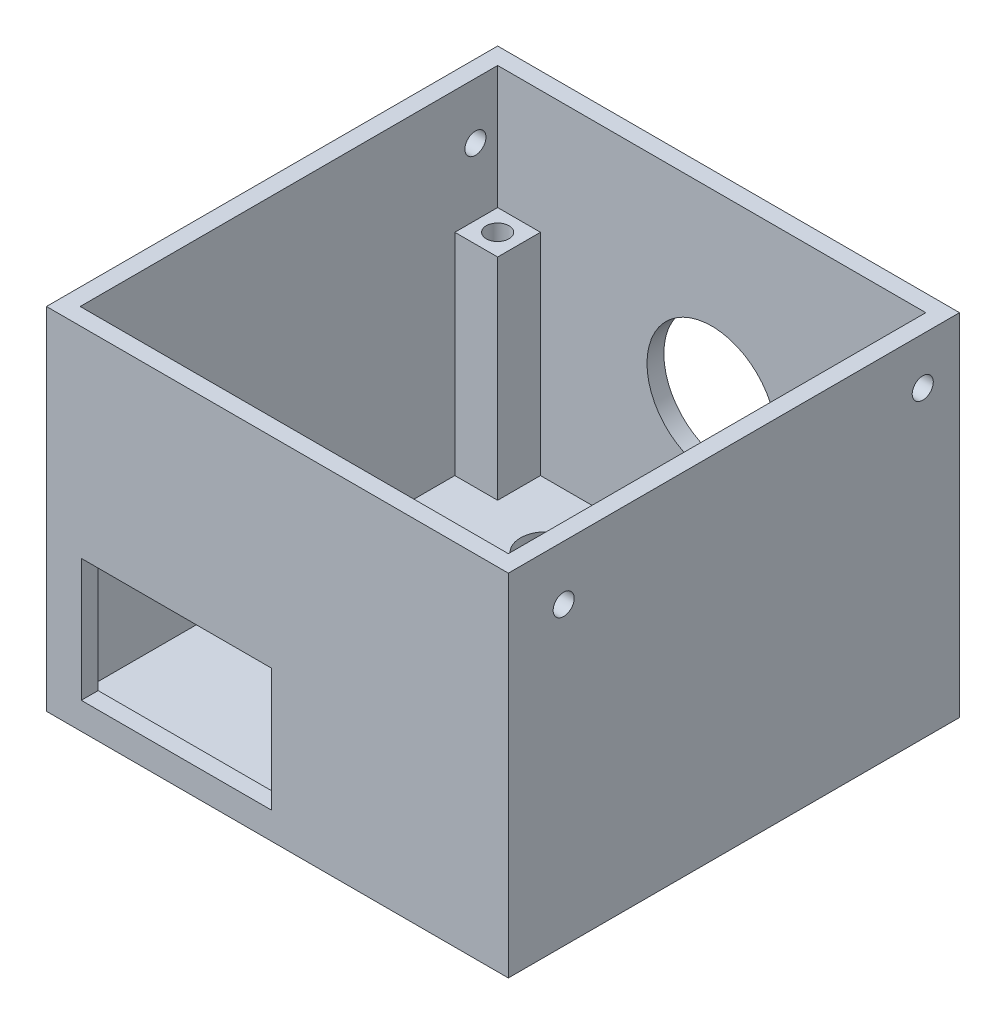
from build123d import *

# Parameters (mm, degrees)
SKETCH1_W           = 54.8
SKETCH1_H           = 53.53
BOSS_EXTRUDE1_DEPTH = 41.6
SKETCH2_W           = 50.8
SKETCH2_H           = 49.53
CUT_EXTRUDE1_DEPTH  = 39.6
SKETCH3_W           = 5.08
SKETCH3_H           = 5.08
BOSS_EXTRUDE2_DEPTH = 25
SKETCH4_R           = 1.35
CUT_EXTRUDE2_DEPTH  = 10
CUT_EXTRUDE3_REACH  = 58.548
SKETCH5_R           = 3
CUT_EXTRUDE4_REACH  = 58.548
SKETCH6_R           = 2
CUT_EXTRUDE5_REACH  = 58.548
SKETCH7_R           = 3.6
CUT_EXTRUDE6_REACH  = 75.824
SKETCH8_R           = 1.25
CUT_EXTRUDE7_REACH  = 75.824
SKETCH10_R          = 1.25
CUT_EXTRUDE8_REACH  = 75.122
SKETCH12_R          = 7.680495542
CUT_EXTRUDE9_REACH  = 75.122
SKETCH13_W          = 22.581735489
SKETCH13_H          = 14.589690318
CUT_EXTRUDE10_REACH = 75.824
SKETCH14_R          = 1.25


with BuildPart() as part:
    # Sketch1 → Boss-Extrude1 (new body)
    with BuildSketch(Plane(origin=(0, 0, 0), x_dir=(1, 0, 0), z_dir=(0, 1, 0))):
        Rectangle(SKETCH1_W, SKETCH1_H)
    extrude(amount=BOSS_EXTRUDE1_DEPTH)

    # Sketch2 → Cut-Extrude1 (cut)
    with BuildSketch(Plane(origin=(0, 41.6, 0), x_dir=(1, 0, 0), z_dir=(0, 1, 0))):
        Rectangle(SKETCH2_W, SKETCH2_H)
    extrude(amount=-CUT_EXTRUDE1_DEPTH, mode=Mode.SUBTRACT)

    # Sketch3 → Boss-Extrude2 (add)
    with BuildSketch(Plane(origin=(0, 2, 0), x_dir=(1, 0, 0), z_dir=(0, 1, 0))):
        with Locations((-22.86, 22.225)):
            Rectangle(SKETCH3_W, SKETCH3_H)
        with Locations((22.86, 22.225)):
            Rectangle(SKETCH3_W, SKETCH3_H)
        with Locations((22.86, -22.225)):
            Rectangle(SKETCH3_W, SKETCH3_H)
    extrude(amount=BOSS_EXTRUDE2_DEPTH)

    # Sketch4 → Cut-Extrude2 (cut)
    with BuildSketch(Plane(origin=(0, 27, 0), x_dir=(1, 0, 0), z_dir=(0, 1, 0))):
        with Locations((-22.86, 22.225)):
            Circle(SKETCH4_R)
        with Locations((22.86, 22.225)):
            Circle(SKETCH4_R)
        with Locations((22.86, -22.225)):
            Circle(SKETCH4_R)
    extrude(amount=-CUT_EXTRUDE2_DEPTH, mode=Mode.SUBTRACT)

    # Sketch5 → Cut-Extrude3 (cut, up to next)
    with BuildSketch(Plane(origin=(0, 0, 0), x_dir=(-1, 0, 0), z_dir=(0, -1, 0)), mode=Mode.PRIVATE) as cut_extrude3_sk1:
        with Locations((-12.762863618, 17.186859774)):
            Circle(SKETCH5_R)
    cut_extrude3_tool1 = extrude(cut_extrude3_sk1.sketch, amount=-CUT_EXTRUDE3_REACH, mode=Mode.PRIVATE) & part.part
    # Sketch5 → Cut-Extrude3 (cut, up to next)
    with BuildSketch(Plane(origin=(0, 0, 0), x_dir=(-1, 0, 0), z_dir=(0, -1, 0)), mode=Mode.PRIVATE) as cut_extrude3_sk2:
        with Locations((12.108357792, 17.186859774)):
            Circle(SKETCH5_R)
    cut_extrude3_tool2 = extrude(cut_extrude3_sk2.sketch, amount=-CUT_EXTRUDE3_REACH, mode=Mode.PRIVATE) & part.part
    add(cut_extrude3_tool1.solids().sort_by_distance((12.762864, 0, -17.18686))[0], mode=Mode.SUBTRACT)
    add(cut_extrude3_tool2.solids().sort_by_distance((-12.108358, 0, -17.18686))[0], mode=Mode.SUBTRACT)

    # Sketch6 → Cut-Extrude4 (cut, up to next)
    with BuildSketch(Plane(origin=(0, 0, 0), x_dir=(-1, 0, 0), z_dir=(0, -1, 0)), mode=Mode.PRIVATE) as cut_extrude4_sk1:
        with Locations((-16.764285658, 3.623143307)):
            Circle(SKETCH6_R)
    cut_extrude4_tool1 = extrude(cut_extrude4_sk1.sketch, amount=-CUT_EXTRUDE4_REACH, mode=Mode.PRIVATE) & part.part
    # Sketch6 → Cut-Extrude4 (cut, up to next)
    with BuildSketch(Plane(origin=(0, 0, 0), x_dir=(-1, 0, 0), z_dir=(0, -1, 0)), mode=Mode.PRIVATE) as cut_extrude4_sk2:
        with Locations((-16.764285658, -2.073626677)):
            Circle(SKETCH6_R)
    cut_extrude4_tool2 = extrude(cut_extrude4_sk2.sketch, amount=-CUT_EXTRUDE4_REACH, mode=Mode.PRIVATE) & part.part
    add(cut_extrude4_tool1.solids().sort_by_distance((16.764286, 0, -3.623143))[0], mode=Mode.SUBTRACT)
    add(cut_extrude4_tool2.solids().sort_by_distance((16.764286, 0, 2.073627))[0], mode=Mode.SUBTRACT)

    # Sketch7 → Cut-Extrude5 (cut, up to next)
    with BuildSketch(Plane(origin=(0, 0, 0), x_dir=(-1, 0, 0), z_dir=(0, -1, 0)), mode=Mode.PRIVATE) as cut_extrude5_sk1:
        with Locations((-16.67782341, -12.007632718)):
            Circle(SKETCH7_R)
    cut_extrude5_tool1 = extrude(cut_extrude5_sk1.sketch, amount=-CUT_EXTRUDE5_REACH, mode=Mode.PRIVATE) & part.part
    add(cut_extrude5_tool1.solids().sort_by_distance((16.677823, 0, 12.007633))[0], mode=Mode.SUBTRACT)

    # Sketch8 → Cut-Extrude6 (cut, up to next)
    with BuildSketch(Plane(origin=(27.4, 0, 0), x_dir=(0, 0, -1), z_dir=(1, 0, 0)), mode=Mode.PRIVATE) as cut_extrude6_sk1:
        with Locations((-20.200858991, 35.113292919)):
            Circle(SKETCH8_R)
    cut_extrude6_tool1 = extrude(cut_extrude6_sk1.sketch, amount=-CUT_EXTRUDE6_REACH, mode=Mode.PRIVATE) & part.part
    add(cut_extrude6_tool1.solids().sort_by_distance((27.4, 35.113293, 20.200859))[0], mode=Mode.SUBTRACT)

    # Sketch10 → Cut-Extrude7 (cut, up to next)
    with BuildSketch(Plane.ZY.offset(27.4), mode=Mode.PRIVATE) as cut_extrude7_sk1:
        with Locations((-22.126795963, 34.935427745)):
            Circle(SKETCH10_R)
    cut_extrude7_tool1 = extrude(cut_extrude7_sk1.sketch, amount=-CUT_EXTRUDE7_REACH, mode=Mode.PRIVATE) & part.part
    add(cut_extrude7_tool1.solids().sort_by_distance((-27.4, 34.935428, -22.126796))[0], mode=Mode.SUBTRACT)

    # Sketch12 → Cut-Extrude8 (cut, up to next)
    with BuildSketch(Plane(origin=(0, 0, -26.765), x_dir=(-1, 0, 0), z_dir=(0, 0, -1)), mode=Mode.PRIVATE) as cut_extrude8_sk1:
        with Locations((0, 19.850785186)):
            Circle(SKETCH12_R)
    cut_extrude8_tool1 = extrude(cut_extrude8_sk1.sketch, amount=-CUT_EXTRUDE8_REACH, mode=Mode.PRIVATE) & part.part
    add(cut_extrude8_tool1.solids().sort_by_distance((0, 19.850785, -26.765))[0], mode=Mode.SUBTRACT)

    # Sketch13 → Cut-Extrude9 (cut, up to next)
    with BuildSketch(Plane.XY.offset(26.765), mode=Mode.PRIVATE) as cut_extrude9_sk1:
        with Locations((-11.980612505, 10.491224969)):
            Rectangle(SKETCH13_W, SKETCH13_H)
    cut_extrude9_tool1 = extrude(cut_extrude9_sk1.sketch, amount=-CUT_EXTRUDE9_REACH, mode=Mode.PRIVATE) & part.part
    add(cut_extrude9_tool1.solids().sort_by_distance((-11.980613, 10.491225, 26.765))[0], mode=Mode.SUBTRACT)

    # Sketch14 → Cut-Extrude10 (cut, up to next)
    with BuildSketch(Plane(origin=(27.4, 0, 0), x_dir=(0, 0, -1), z_dir=(1, 0, 0)), mode=Mode.PRIVATE) as cut_extrude10_sk1:
        with Locations((22.403153775, 36.040667921)):
            Circle(SKETCH14_R)
    cut_extrude10_tool1 = extrude(cut_extrude10_sk1.sketch, amount=-CUT_EXTRUDE10_REACH, mode=Mode.PRIVATE) & part.part
    add(cut_extrude10_tool1.solids().sort_by_distance((27.4, 36.040668, -22.403154))[0], mode=Mode.SUBTRACT)


solid = part.part
